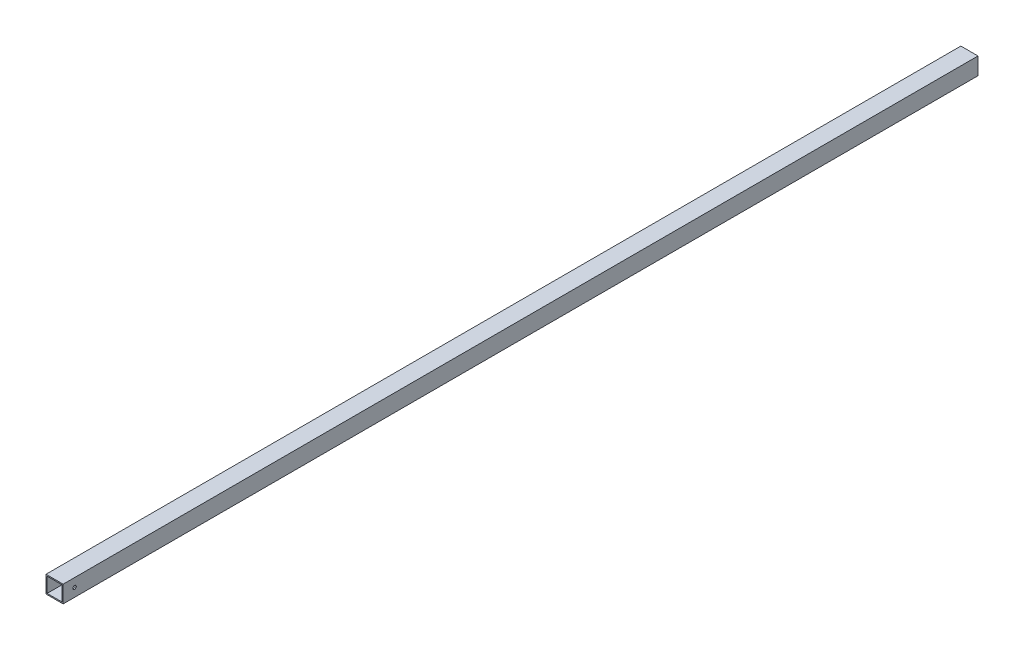
from build123d import *

# Parameters (mm, degrees)
SKETCH_1_W          = 15
SKETCH_1_H          = 15
SKETCH_1_W_2        = 13
SKETCH_1_H_2        = 13
EXTRUDE_1_DEPTH     = 800
SKETCH_4_R          = 1.5
CUT_EXTRUDE_3_DEPTH = 801.281200579


with BuildPart() as part:
    # 草图1 → 拉伸-薄壁1 (new body)
    with BuildSketch(Plane.XY):
        with Locations((7.5, -7.5)):
            Rectangle(SKETCH_1_W, SKETCH_1_H)
        with Locations((7.5, -7.5)):
            Rectangle(SKETCH_1_W_2, SKETCH_1_H_2, mode=Mode.SUBTRACT)
    extrude(amount=EXTRUDE_1_DEPTH)

    # 草图4 → 切除-拉伸3 (cut, through all)
    with BuildSketch(Plane(origin=(15, 0, 0), x_dir=(0, 0, -1), z_dir=(1, 0, 0))):
        with Locations((-790, -7.5)):
            Circle(SKETCH_4_R)
    extrude(amount=-CUT_EXTRUDE_3_DEPTH, mode=Mode.SUBTRACT)


solid = part.part
